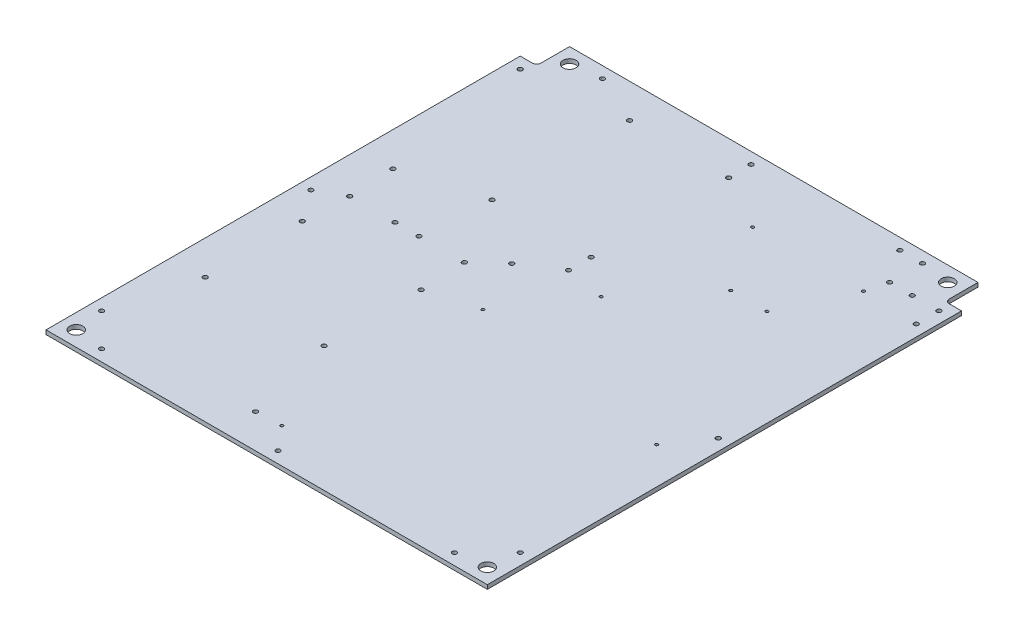
from build123d import *

# Parameters (mm, degrees)
SKETCH1_W               = 340.868
SKETCH1_H               = 391.668
BOSS_EXTRUDE1_DEPTH     = 3.175
CUT_EXTRUDE1_DEPTH      = 10
F_3_8_CLEARANCE_HOLE1_D = 10.0838
F_4_40_TAPPED_HOLE2_D   = 2.2606
F_8_32_TAPPED_HOLE2_D   = 3.4544


with BuildPart() as part:
    # Sketch1 → Boss-Extrude1 (new body)
    with BuildSketch(Plane(origin=(0, 0, 0), x_dir=(1, 0, 0), z_dir=(0, 1, 0))):
        Rectangle(SKETCH1_W, SKETCH1_H)
    extrude(amount=BOSS_EXTRUDE1_DEPTH)

    # Sketch2 → Cut-Extrude1 (cut)
    with BuildSketch(Plane(origin=(0, 3.175, 0), x_dir=(1, 0, 0), z_dir=(0, 1, 0))):
        with BuildLine():
            Line((-170.434, 195.834), (-157.734, 195.834))
            Line((-157.734, 195.834), (-157.734, 173.609))
            ThreePointArc((-157.734, 173.609), (-158.66393597, 171.36393597), (-160.909, 170.434))
            Line((-160.909, 170.434), (-170.434, 170.434))
            Line((-170.434, 170.434), (-170.434, 195.834))
        make_face()
        with BuildLine():
            Line((170.434, 195.834), (157.734, 195.834))
            Line((157.734, 195.834), (157.734, 173.609))
            ThreePointArc((157.734, 173.609), (158.66393597, 171.36393597), (160.909, 170.434))
            Line((160.909, 170.434), (170.434, 170.434))
            Line((170.434, 170.434), (170.434, 195.834))
        make_face()
    extrude(amount=-CUT_EXTRUDE1_DEPTH, mode=Mode.SUBTRACT)

    # 3/8 Clearance Hole1 (through all)
    with Locations(Plane(origin=(0, 3.175, 0), x_dir=(1, 0, 0), z_dir=(0, 1, 0))):
        with Locations((158.75, -184.15), (-158.75, -184.15), (-146.05, 184.15), (146.05, 184.15)):
            Hole(F_3_8_CLEARANCE_HOLE1_D / 2)

    # #4-40 Tapped Hole2 (through all)
    with Locations(Plane(origin=(0, 3.175, 0), x_dir=(1, 0, 0), z_dir=(0, 1, 0))):
        with Locations((119.375, 145.759), (33.725, 145.759), (21.73, 40.754), (67.7, 94.894), (95.6, 94.894), (-15.34, -13.51), (142.14, -36.73), (-15.34, -168.81)):
            Hole(F_4_40_TAPPED_HOLE2_D / 2)

    # #8-32 Tapped Hole2 (through all)
    with Locations(Plane(origin=(0, 3.175, 0), x_dir=(1, 0, 0), z_dir=(0, 1, 0))):
        with Locations((-161.684, -161.684), (-161.684, 0), (-161.684, 161.684), (-144.184, 45.834), (-8.584, 45.834), (-144.184, -24.166), (-52.384, -24.166), (-144.184, -99.166), (-52.384, -99.166), (-34.884, 28.334), (-34.884, -169.584), (-136.284, -187.084), (0, -187.084), (136.284, -187.084), (161.684, -161.684), (161.684, -8.75), (161.684, 144.184), (141.084, 161.684), (161.684, 161.684), (123.584, 161.684), (123.584, 187.084), (106.084, 187.084), (-123.584, 187.084), (-8.75, 187.084), (-8.584, 169.584), (-8.584, 63.334), (-142.534, 10.834), (-107.534, 10.834), (-89.034, 10.834), (-54.034, 10.834), (-85.134, 63.334), (-85.134, 169.584)):
            Hole(F_8_32_TAPPED_HOLE2_D / 2)


solid = part.part
